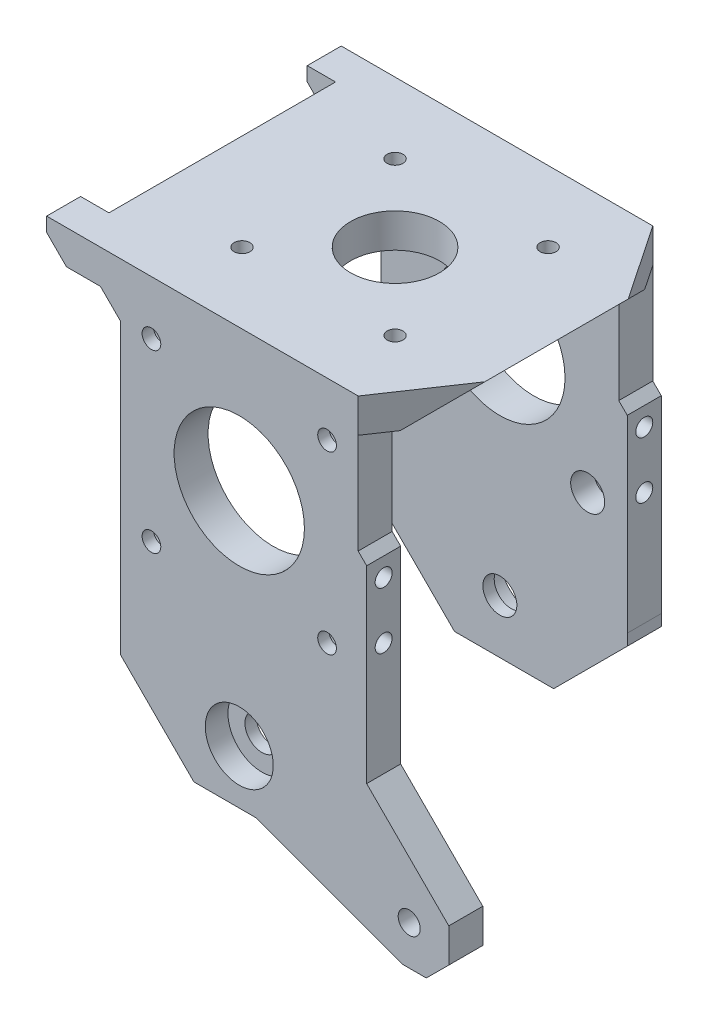
from build123d import *

# Parameters (mm, degrees)
BOSS_EXTRUDE1_DEPTH = 52
BOSS_EXTRUDE3_START = 52
BOSS_EXTRUDE3_DEPTH = 6
CUT_EXTRUDE5_DEPTH  = 76
SKETCH9_W           = 5
SKETCH9_H           = 28
SKETCH9_R           = 7.85
SKETCH9_R_2         = 1.4
CUT_EXTRUDE6_DEPTH  = 21
SKETCH14_R          = 11.5
SKETCH14_R_2        = 1.65
SKETCH14_R_3        = 3
SKETCH14_R_4        = 1.95
CUT_EXTRUDE7_DEPTH  = 62
SKETCH25_R          = 3
CUT_EXTRUDE8_DEPTH  = 3.5
SKETCH26_R          = 6
CUT_EXTRUDE9_DEPTH  = 4
CUT_EXTRUDE10_START = -4
SKETCH27_R          = 6
CUT_EXTRUDE10_DEPTH = 4
SKETCH34_R          = 3
CUT_EXTRUDE11_DEPTH = 4
CUT_EXTRUDE12_START = -4
SKETCH35_R          = 3
CUT_EXTRUDE12_DEPTH = 4
SKETCH36_R          = 4
CUT_EXTRUDE13_DEPTH = 3
SKETCH37_R          = 1.5
CUT_EXTRUDE14_DEPTH = 5
SKETCH38_R          = 1.6
CUT_EXTRUDE15_DEPTH = 4
CUT_EXTRUDE16_START = -6
CUT_EXTRUDE16_DEPTH = 40


with BuildPart() as part:
    # Sketch1 → Boss-Extrude1 (new body)
    with BuildSketch(Plane.XY):
        Polygon((31.992612588, 32.452997252), (38.003020228, 38.463404892), (-25.996979772, 38.463404892), (-25.996979772, 35.963404892), (-22.496801205, 32.463226325), (-16.496801205, 32.463226325), (-12.996622638, 28.963047758), (-12.996622638, -22.036952242), (0, -35.03357488), (10.9, -35.03357488), (17.5, -35.03357488), (30.510764774, -22.022810106), (30.491678964, -20.046069124), (30.491678964, 13.253930876), (28.992612588, 14.752997252), (28.992612588, 32.452997252), align=None)
    extrude(amount=BOSS_EXTRUDE1_DEPTH)

    # Sketch1<4> → Boss-Extrude3 (add)
    with BuildSketch(Plane.XY.offset(BOSS_EXTRUDE3_START)):
        Polygon((44.987367978, -34.541758139), (30.491678964, -20.046069124), (30.510764774, -22.022810106), (17.5, -35.03357488), (10.9, -35.03357488), (36.910691743, -44.500692447), (41.010691743, -44.500692447), (44.987367978, -40.541758139), align=None)
    extrude(amount=-BOSS_EXTRUDE3_DEPTH)

    # Sketch8 → Cut-Extrude5 (cut)
    with BuildSketch(Plane(origin=(40.491678964, 0, 0), x_dir=(0, 0, -1), z_dir=(1, 0, 0))):
        Polygon((-46, -49.839210224), (-6, -35.03357488), (-6, 32.452997252), (-46, 32.452997252), align=None)
    extrude(amount=-CUT_EXTRUDE5_DEPTH, mode=Mode.SUBTRACT)

    # Sketch9 → Cut-Extrude6 (cut)
    with BuildSketch(Plane(origin=(0, 38.463404892, 0), x_dir=(1, 0, 0), z_dir=(0, 1, 0))):
        with Locations((-23.496979772, -26)):
            Rectangle(SKETCH9_W, SKETCH9_H)
        Polygon((37.951108861, -38.736074871), (29.003020228, -52), (38.003020228, -52), (38.003020228, -38.759111283), align=None)
        Polygon((38.003020228, 0), (29.003020228, 0), (37.951108861, -13.263925129), (38.003020228, -13.220806137), align=None)
        with Locations((9.503020228, -26)):
            Circle(SKETCH9_R)
        with Locations((-4.002719293, -12.494260479)):
            Circle(SKETCH9_R_2)
        with Locations((23.008759749, -12.494260479)):
            Circle(SKETCH9_R_2)
        with Locations((23.008759749, -39.505739521)):
            Circle(SKETCH9_R_2)
        with Locations((-4.002719293, -39.505739521)):
            Circle(SKETCH9_R_2)
    extrude(amount=-CUT_EXTRUDE6_DEPTH, mode=Mode.SUBTRACT)

    # Sketch14 → Cut-Extrude7 (cut)
    with BuildSketch(Plane.XY.offset(52)):
        with Locations((8.003377362, 13.463404892)):
            Circle(SKETCH14_R)
        with Locations((-7.496403282, -2.036375752)):
            Circle(SKETCH14_R_2)
        with Locations((-7.496403282, 28.963185535)):
            Circle(SKETCH14_R_2)
        with Locations((23.503158005, 28.963185535)):
            Circle(SKETCH14_R_2)
        with Locations((23.503158005, -2.036375752)):
            Circle(SKETCH14_R_2)
        with Locations((8.003377362, -25.536595108)):
            Circle(SKETCH14_R_3)
        with Locations((38.002754428, -37.535489875)):
            Circle(SKETCH14_R_4)
    extrude(amount=-CUT_EXTRUDE7_DEPTH, mode=Mode.SUBTRACT)

    # Sketch25 → Cut-Extrude8 (cut)
    with BuildSketch(Plane.XZ.offset(-32.452997252)):
        with Locations((-4.002719293, 39.505739521)):
            Circle(SKETCH25_R)
        with Locations((23.008759749, 39.505739521)):
            Circle(SKETCH25_R)
        with Locations((23.008759749, 12.494260479)):
            Circle(SKETCH25_R)
        with Locations((-4.002719293, 12.494260479)):
            Circle(SKETCH25_R)
    extrude(amount=-CUT_EXTRUDE8_DEPTH, mode=Mode.SUBTRACT)

    # Sketch26 → Cut-Extrude9 (cut)
    with BuildSketch(Plane(origin=(0, 0, 0), x_dir=(-1, 0, 0), z_dir=(0, 0, -1))):
        with Locations((-8.003377362, -25.536595108)):
            Circle(SKETCH26_R)
    extrude(amount=-CUT_EXTRUDE9_DEPTH, mode=Mode.SUBTRACT)

    # Sketch27 → Cut-Extrude10 (cut)
    with BuildSketch(Plane.XY.offset(52).offset(CUT_EXTRUDE10_START)):
        with Locations((8.003377362, -25.536595108)):
            Circle(SKETCH27_R)
    extrude(amount=CUT_EXTRUDE10_DEPTH, mode=Mode.SUBTRACT)

    # Sketch34 → Cut-Extrude11 (cut)
    with BuildSketch(Plane(origin=(0, 0, 46), x_dir=(-1, 0, 0), z_dir=(0, 0, -1))):
        with Locations((-23.503158005, 28.963185535)):
            Circle(SKETCH34_R)
        with Locations((7.496403282, 28.963185535)):
            Circle(SKETCH34_R)
        with Locations((7.496403282, -2.036375752)):
            Circle(SKETCH34_R)
        with Locations((-23.503158005, -2.036375752)):
            Circle(SKETCH34_R)
    extrude(amount=-CUT_EXTRUDE11_DEPTH, mode=Mode.SUBTRACT)

    # Sketch35 → Cut-Extrude12 (cut)
    with BuildSketch(Plane.XY.offset(6).offset(CUT_EXTRUDE12_START)):
        with Locations((-7.496403282, 28.963185535)):
            Circle(SKETCH35_R)
        with Locations((23.503158005, -2.036375752)):
            Circle(SKETCH35_R)
        with Locations((-7.496403282, -2.036375752)):
            Circle(SKETCH35_R)
        with Locations((23.503158005, 28.963185535)):
            Circle(SKETCH35_R)
    extrude(amount=CUT_EXTRUDE12_DEPTH, mode=Mode.SUBTRACT)

    # Sketch36 → Cut-Extrude13 (cut)
    with BuildSketch(Plane(origin=(0, 0, 46), x_dir=(-1, 0, 0), z_dir=(0, 0, -1))):
        with Locations((-38.002754428, -37.535489875)):
            Circle(SKETCH36_R)
    extrude(amount=-CUT_EXTRUDE13_DEPTH, mode=Mode.SUBTRACT)

    # Sketch37 → Cut-Extrude14 (cut)
    with BuildSketch(Plane(origin=(30.491678964, 0, 0), x_dir=(0, 0, -1), z_dir=(1, 0, 0))):
        with Locations((-3, 9.953930876)):
            Circle(SKETCH37_R)
        with Locations((-3, -0.046069124)):
            Circle(SKETCH37_R)
        with Locations((-49, 9.953930876)):
            Circle(SKETCH37_R)
        with Locations((-49, -0.046069124)):
            Circle(SKETCH37_R)
    extrude(amount=-CUT_EXTRUDE14_DEPTH, mode=Mode.SUBTRACT)

    # Sketch38 → Cut-Extrude15 (cut)
    with BuildSketch(Plane.ZY.offset(12.996622638)):
        with Locations((49, 13.963047758)):
            Circle(SKETCH38_R)
        with Locations((49, 3.963047758)):
            Circle(SKETCH38_R)
        with Locations((3, 13.963047758)):
            Circle(SKETCH38_R)
        with Locations((3, 3.963047758)):
            Circle(SKETCH38_R)
    extrude(amount=-CUT_EXTRUDE15_DEPTH, mode=Mode.SUBTRACT)

    # Sketch39 → Cut-Extrude16 (cut)
    with BuildSketch(Plane.XY.offset(12).offset(CUT_EXTRUDE16_START)):
        Polygon((-22.496979772, 38.463404892), (-25.996979772, 38.463404892), (-28.276459711, 32.970357014), (-19.102709926, 28.692570726), (-16.496801205, 32.463226325), (-20.996979772, 38.463404892), align=None)
    extrude(amount=CUT_EXTRUDE16_DEPTH, mode=Mode.SUBTRACT)


solid = part.part
